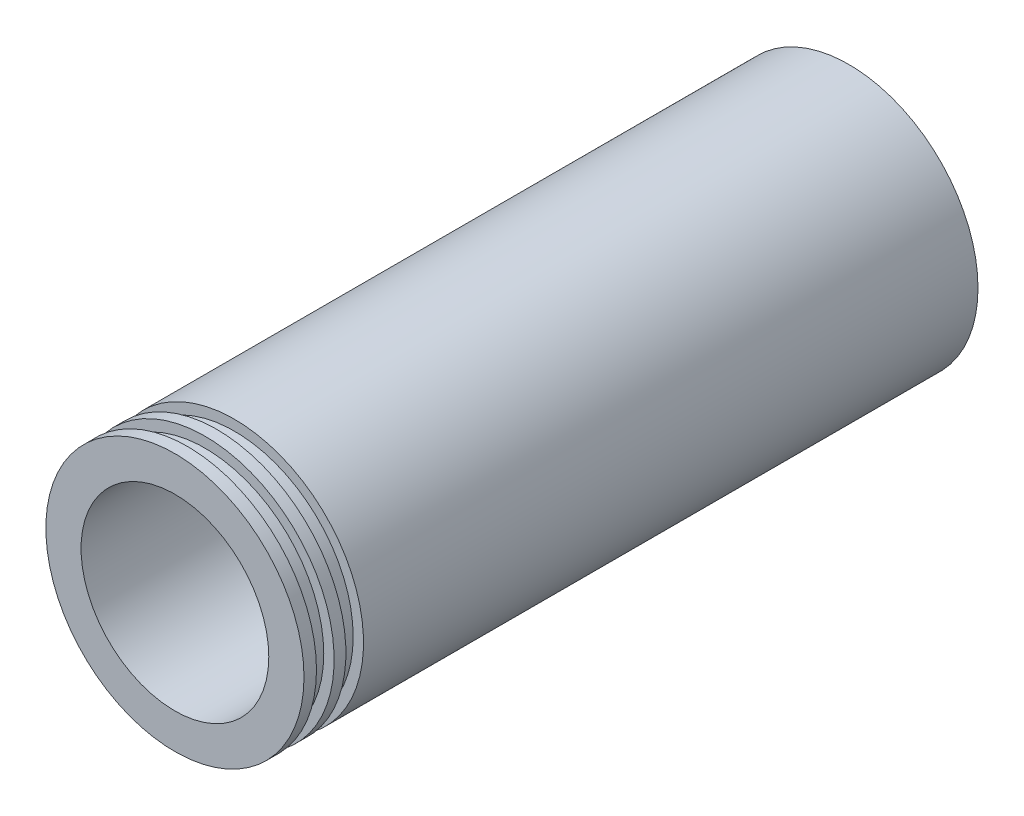
from build123d import *

# Parameters (mm, degrees)
SKETCH1_R           = 34.925
SKETCH1_R_2         = 25.4
BOSS_EXTRUDE1_DEPTH = 182.372
CUT_EXTRUDE1_REACH  = 190.942
SKETCH2_R           = 5.588


with BuildPart() as part:
    # Sketch1 → Boss-Extrude1 (new body)
    with BuildSketch(Plane.XY):
        Circle(SKETCH1_R)
        Circle(SKETCH1_R_2, mode=Mode.SUBTRACT)
    extrude(amount=BOSS_EXTRUDE1_DEPTH)

    # Sketch2 → Cut-Extrude1 (cut, up to next)
    with BuildSketch(Plane(origin=(0, 0, 0), x_dir=(1, 0, 0), z_dir=(0, 1, 0)), mode=Mode.PRIVATE) as cut_extrude1_sk1:
        with Locations((0, -38.1)):
            Circle(SKETCH2_R)
    cut_extrude1_tool1 = extrude(cut_extrude1_sk1.sketch, amount=-CUT_EXTRUDE1_REACH, mode=Mode.PRIVATE) & part.part
    add(cut_extrude1_tool1.solids().sort_by_distance((0, 0, 38.1))[0], mode=Mode.SUBTRACT)

    # Cut-Sweep1: sweep along a path in groove path
    with BuildLine(Plane.XY.offset(171.031003689)) as cut_sweep1_path:
        CenterArc((0, 0), 34.925, 0, 360)
    # groove → Cut-Sweep1 (sweep, cut)
    with BuildSketch(Plane(origin=(0, 0, 0), x_dir=(0, 0, -1), z_dir=(1, 0, 0))):
        Polygon((-178.993903689, 34.925), (-178.993903689, 32.131), (-174.231403689, 32.131), (-174.218703689, 34.925), (-171.031003689, 34.925), (-171.031003689, 32.131), (-166.268503689, 32.131), (-166.268503689, 34.925), (-166.268503689, 38.1), (-178.993903689, 38.1), align=None)
    sweep(path=cut_sweep1_path.line, mode=Mode.SUBTRACT)


solid = part.part
